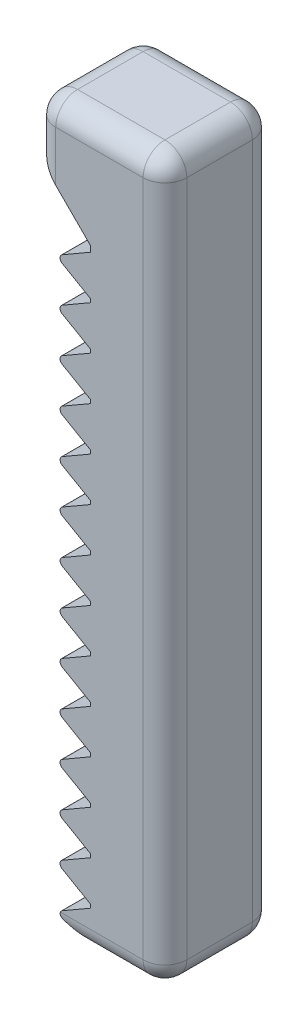
from build123d import *

# Parameters (mm, degrees)
SKETCH1_W               = 6
SKETCH1_H               = 5
BOSS_EXTRUDE1_DEPTH     = 33
CUT_EXTRUDE1_DEPTH      = 34.51119216
CUT_EXTRUDE1_DEPTH_BACK = 34.51119216
BOSS_EXTRUDE2_DEPTH     = 5
LPATTERN1_COUNT         = 14
LPATTERN1_PITCH         = 2
FILLET1_R               = 1


with BuildPart() as part:
    # Sketch1 → Boss-Extrude1 (new body)
    with BuildSketch(Plane(origin=(0, 0, 0), x_dir=(1, 0, 0), z_dir=(0, 1, 0))):
        Rectangle(SKETCH1_W, SKETCH1_H)
    extrude(amount=BOSS_EXTRUDE1_DEPTH)

    # Sketch2 → Cut-Extrude1 (cut, two sides: drawn at the far end of the back side and taken through both)
    with BuildSketch(Plane(origin=(0, 0, -2.5), x_dir=(-1, 0, 0), z_dir=(0, 0, -1)).offset(-CUT_EXTRUDE1_DEPTH_BACK)):
        Polygon((3, 2.5), (3, 30.7), (0.4, 28.1), (0.4, 5.1), (0.4, 0), (3, 0), align=None)
    extrude(amount=CUT_EXTRUDE1_DEPTH + CUT_EXTRUDE1_DEPTH_BACK, mode=Mode.SUBTRACT)

    # Sketch3 → Boss-Extrude2 (add)
    with BuildSketch(Plane(origin=(0, 0, -2.5), x_dir=(-1, 0, 0), z_dir=(0, 0, -1))):
        with BuildLine():
            Line((0.4, 0), (1.7, 0.75055535))
            ThreePointArc((1.7, 0.75055535), (1.8, 0.923760431), (1.7, 1.096965511))
            Line((1.7, 1.096965511), (0.4, 1.847520861))
            Line((0.4, 1.847520861), (0.4, 0))
        make_face()
    boss_extrude2 = extrude(amount=-BOSS_EXTRUDE2_DEPTH)

    # LPattern1: Boss-Extrude2 ×14
    with Locations(*[(0, i * LPATTERN1_PITCH, 0) for i in range(1, LPATTERN1_COUNT)]):
        add(boss_extrude2)

    # Fillet1
    # the kernel refuses this fillet: 1 mm, written as the material it takes off along each edge
    with BuildSketch(Plane(origin=(2, 1, -1.5), x_dir=(1, 0, 0), z_dir=(0, 0, -1))) as fillet1_piece_1_section:
        Polygon((0, 0), (FILLET1_R, 0), (FILLET1_R, FILLET1_R), (0, FILLET1_R), align=None)
    fillet1_piece_1 = extrude(amount=FILLET1_R, mode=Mode.PRIVATE)
    fillet1_piece_1 = fillet1_piece_1 - Plane(origin=(2, 1, -1.5), x_dir=(-0.7071067811865475, 0.7071067811865475, 0), z_dir=(0, 0, -1)) * Sphere(FILLET1_R, mode=Mode.PRIVATE)
    add(fillet1_piece_1, mode=Mode.SUBTRACT)
    with BuildSketch(Plane(origin=(2, 1, 1.5), x_dir=(1, 0, 0), z_dir=(0, 0, 1))) as fillet1_piece_2_section:
        Polygon((0, 0), (FILLET1_R, 0), (FILLET1_R, -FILLET1_R), (0, -FILLET1_R), align=None)
    fillet1_piece_2 = extrude(amount=FILLET1_R, mode=Mode.PRIVATE)
    fillet1_piece_2 = fillet1_piece_2 - Plane(origin=(2, 1, 1.5), x_dir=(-0.7071067811865475, 0.7071067811865475, 0), z_dir=(0, 0, 1)) * Sphere(FILLET1_R, mode=Mode.PRIVATE)
    add(fillet1_piece_2, mode=Mode.SUBTRACT)
    with BuildSketch(Plane(origin=(-2, 32, -1.5), x_dir=(-1, 0, 0), z_dir=(0, 0, -1))) as fillet1_piece_3_section:
        Polygon((0, 0), (FILLET1_R, 0), (FILLET1_R, FILLET1_R), (0, FILLET1_R), align=None)
    fillet1_piece_3 = extrude(amount=FILLET1_R, mode=Mode.PRIVATE)
    fillet1_piece_3 = fillet1_piece_3 - Plane(origin=(-2, 32, -1.5), x_dir=(0.7071067811865475, -0.7071067811865475, 0), z_dir=(0, 0, -1)) * Sphere(FILLET1_R, mode=Mode.PRIVATE)
    add(fillet1_piece_3, mode=Mode.SUBTRACT)
    with BuildSketch(Plane(origin=(-2, 32, 1.5), x_dir=(-1, 0, 0), z_dir=(0, 0, 1))) as fillet1_piece_4_section:
        Polygon((0, 0), (FILLET1_R, 0), (FILLET1_R, -FILLET1_R), (0, -FILLET1_R), align=None)
    fillet1_piece_4 = extrude(amount=FILLET1_R, mode=Mode.PRIVATE)
    fillet1_piece_4 = fillet1_piece_4 - Plane(origin=(-2, 32, 1.5), x_dir=(0.7071067811865475, -0.7071067811865475, 0), z_dir=(0, 0, 1)) * Sphere(FILLET1_R, mode=Mode.PRIVATE)
    add(fillet1_piece_4, mode=Mode.SUBTRACT)
    with BuildSketch(Plane(origin=(2, 32, 1.5), x_dir=(0, 1, 0), z_dir=(0, 0, 1))) as fillet1_piece_5_section:
        Polygon((0, 0), (FILLET1_R, 0), (FILLET1_R, -FILLET1_R), (0, -FILLET1_R), align=None)
    fillet1_piece_5 = extrude(amount=FILLET1_R, mode=Mode.PRIVATE)
    fillet1_piece_5 = fillet1_piece_5 - Plane(origin=(2, 32, 1.5), x_dir=(-0.7071067811865475, -0.7071067811865475, 0), z_dir=(0, 0, 1)) * Sphere(FILLET1_R, mode=Mode.PRIVATE)
    add(fillet1_piece_5, mode=Mode.SUBTRACT)
    with BuildSketch(Plane(origin=(2, 32, -1.5), x_dir=(0, 1, 0), z_dir=(0, 0, -1))) as fillet1_piece_6_section:
        Polygon((0, 0), (FILLET1_R, 0), (FILLET1_R, FILLET1_R), (0, FILLET1_R), align=None)
    fillet1_piece_6 = extrude(amount=FILLET1_R, mode=Mode.PRIVATE)
    fillet1_piece_6 = fillet1_piece_6 - Plane(origin=(2, 32, -1.5), x_dir=(-0.7071067811865475, -0.7071067811865475, 0), z_dir=(0, 0, -1)) * Sphere(FILLET1_R, mode=Mode.PRIVATE)
    add(fillet1_piece_6, mode=Mode.SUBTRACT)
    with BuildSketch(Plane(origin=(2, 0, -2.5), x_dir=(0, 0, 1), z_dir=(-1, 0, 0))) as fillet1_piece_7:
        with BuildLine():
            CenterArc((FILLET1_R, FILLET1_R), FILLET1_R, 180, 90)
            Line((0, FILLET1_R), (0, 0))
            Line((0, 0), (FILLET1_R, 0))
        make_face()
    extrude(amount=4.9, mode=Mode.SUBTRACT)
    with BuildSketch(Plane(origin=(-2.9, 0, 2.5), x_dir=(0, 1, 0), z_dir=(1, 0, 0))) as fillet1_piece_8:
        with BuildLine():
            CenterArc((FILLET1_R, -FILLET1_R), FILLET1_R, 90, 90)
            Line((0, -FILLET1_R), (0, 0))
            Line((0, 0), (FILLET1_R, 0))
        make_face()
    extrude(amount=4.9, mode=Mode.SUBTRACT)
    with BuildSketch(Plane(origin=(-3, 33, -1.5), x_dir=(0, -1, 0), z_dir=(0, 0, 1))) as fillet1_piece_9:
        with BuildLine():
            CenterArc((FILLET1_R, FILLET1_R), FILLET1_R, 180, 90)
            Line((0, FILLET1_R), (0, 0))
            Line((0, 0), (FILLET1_R, 0))
        make_face()
    extrude(amount=3, mode=Mode.SUBTRACT)
    with BuildSketch(Plane(origin=(-3, 28.2, 2.5), x_dir=(1, 0, 0), z_dir=(0, 1, 0)), Plane(origin=(-3, 28.2, -2.5), x_dir=(0, 0, 1), z_dir=(0, 1, 0))) as fillet1_piece_10:
        with BuildLine():
            CenterArc((FILLET1_R, FILLET1_R), FILLET1_R, 180, 90)
            Line((0, FILLET1_R), (0, 0))
            Line((0, 0), (FILLET1_R, 0))
        make_face()
    extrude(amount=3.8, mode=Mode.SUBTRACT)
    with BuildSketch(Plane(origin=(-3, 30.7, 3.535533906), x_dir=(0.7071067811865411, -0.7071067811865539, 0), z_dir=(0, 0, -1))) as fillet1_piece_11:
        with BuildLine():
            CenterArc((FILLET1_R * 0.414213562373, -FILLET1_R), FILLET1_R, 90, 45)
            Line((-FILLET1_R * 0.292893218813, -FILLET1_R * 0.292893218813), (0, 0))
            Line((0, 0), (FILLET1_R * 0.414213562373, 0))
        make_face()
    extrude(amount=7.071067812, mode=Mode.SUBTRACT)
    with BuildSketch(Plane(origin=(3, 1, 2.5), x_dir=(-1, 0, 0), z_dir=(0, 1, 0)), Plane(origin=(3, 1, -2.5), x_dir=(0, 0, 1), z_dir=(0, 1, 0))) as fillet1_piece_12:
        with BuildLine():
            CenterArc((FILLET1_R, -FILLET1_R), FILLET1_R, 90, 90)
            Line((0, -FILLET1_R), (0, 0))
            Line((0, 0), (FILLET1_R, 0))
        make_face()
    extrude(amount=31, mode=Mode.SUBTRACT)
    with BuildSketch(Plane(origin=(3, 33, 1.5), x_dir=(-1, 0, 0), z_dir=(0, 0, -1)), Plane(origin=(3, 0, 1.5), x_dir=(0, 1, 0), z_dir=(0, 0, -1))) as fillet1_piece_13:
        with BuildLine():
            CenterArc((FILLET1_R, -FILLET1_R), FILLET1_R, 90, 90)
            Line((0, -FILLET1_R), (0, 0))
            Line((0, 0), (FILLET1_R, 0))
        make_face()
    extrude(amount=3, mode=Mode.SUBTRACT)
    with BuildSketch(Plane(origin=(-2, 33, 2.5), x_dir=(0, -1, 0), z_dir=(1, 0, 0))) as fillet1_piece_14:
        with BuildLine():
            CenterArc((FILLET1_R, FILLET1_R), FILLET1_R, 180, 90)
            Line((0, FILLET1_R), (0, 0))
            Line((0, 0), (FILLET1_R, 0))
        make_face()
    extrude(amount=4, mode=Mode.SUBTRACT)
    with BuildSketch(Plane(origin=(2, 33, -2.5), x_dir=(0, 0, 1), z_dir=(-1, 0, 0))) as fillet1_piece_15:
        with BuildLine():
            CenterArc((FILLET1_R, -FILLET1_R), FILLET1_R, 90, 90)
            Line((0, -FILLET1_R), (0, 0))
            Line((0, 0), (FILLET1_R, 0))
        make_face()
    extrude(amount=4, mode=Mode.SUBTRACT)
    with BuildSketch(Plane(origin=(-0.4, 0, -3.169872981), x_dir=(1, 0, 0), z_dir=(0, 0, 1))) as fillet1_piece_16:
        with BuildLine():
            CenterArc((FILLET1_R * 0.267949192431, FILLET1_R), FILLET1_R, 240, 30)
            Line((-FILLET1_R * 0.232050807569, FILLET1_R * 0.133974596216), (0, 0))
            Line((0, 0), (FILLET1_R * 0.267949192431, 0))
        make_face()
    extrude(amount=6.339745962, mode=Mode.SUBTRACT)


solid = part.part
